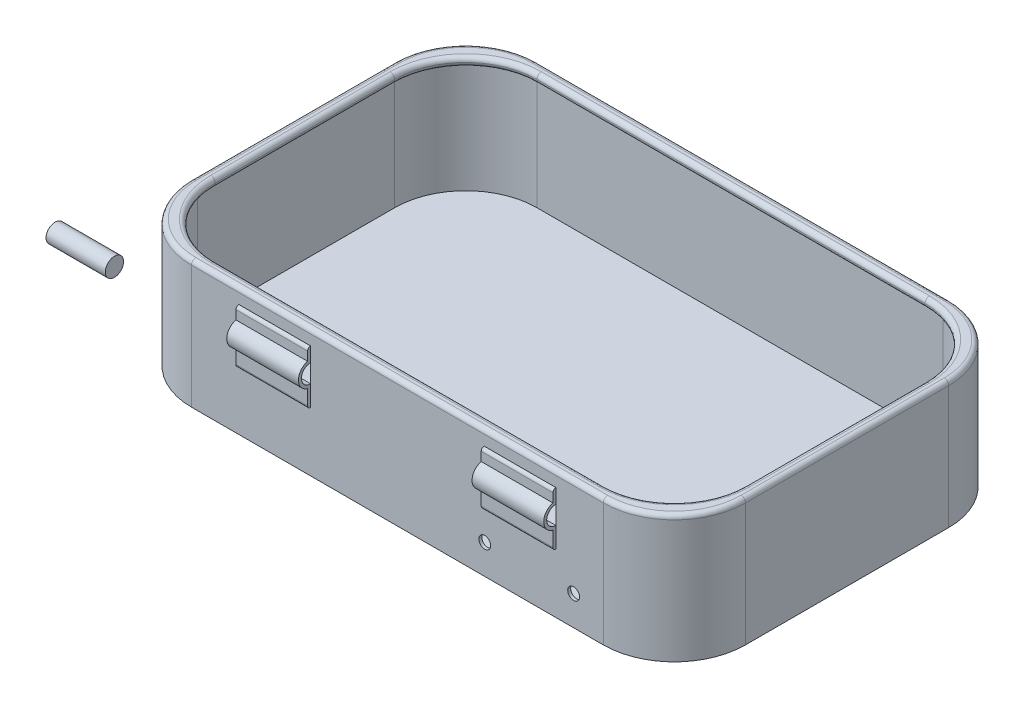
from build123d import *

# Parameters (mm, degrees)
SKETCH1_W           = 93.5
SKETCH1_H           = 58.3
BOSS_EXTRUDE1_DEPTH = 0.5
SKETCH2_W           = 93.5
SKETCH2_H           = 58.3
SKETCH2_W_2         = 92.5
SKETCH2_H_2         = 57.3
BOSS_EXTRUDE2_DEPTH = 21
SKETCH3_W           = 92.5
SKETCH3_H           = 57.3
SKETCH3_W_2         = 89.5
SKETCH3_H_2         = 54.3
BOSS_EXTRUDE3_DEPTH = 1.5
FILLET2_R           = 12
FILLET3_R           = 0.749
SKETCH4_W           = 12.1
SKETCH4_H           = 9
CUT_EXTRUDE1_DEPTH  = 0.5
BOSS_EXTRUDE4_START = -20
BOSS_EXTRUDE4_DEPTH = 12.1
BOSS_EXTRUDE5_START = -61.4
BOSS_EXTRUDE5_DEPTH = 12.1
FILLET4_R           = 0.5
FILLET5_R           = 0.5
SKETCH6_R           = 1.55
BOSS_EXTRUDE6_DEPTH = 10
SKETCH7_R           = 1
CUT_EXTRUDE2_DEPTH  = 0.5


with BuildPart() as part:
    # Sketch1 → Boss-Extrude1 (new body)
    with BuildSketch(Plane(origin=(0, 0, 0), x_dir=(1, 0, 0), z_dir=(0, 1, 0))):
        Rectangle(SKETCH1_W, SKETCH1_H)
    extrude(amount=BOSS_EXTRUDE1_DEPTH)

    # Sketch2 → Boss-Extrude2 (add)
    with BuildSketch(Plane(origin=(0, 0.5, 0), x_dir=(1, 0, 0), z_dir=(0, 1, 0))):
        Rectangle(SKETCH2_W, SKETCH2_H)
        Rectangle(SKETCH2_W_2, SKETCH2_H_2, mode=Mode.SUBTRACT)
    extrude(amount=BOSS_EXTRUDE2_DEPTH)

    # Sketch3 → Boss-Extrude3 (add)
    with BuildSketch(Plane(origin=(0, 21.5, 0), x_dir=(1, 0, 0), z_dir=(0, 1, 0))):
        Rectangle(SKETCH3_W, SKETCH3_H)
        Rectangle(SKETCH3_W_2, SKETCH3_H_2, mode=Mode.SUBTRACT)
    extrude(amount=-BOSS_EXTRUDE3_DEPTH)

    # Fillet2
    fillet2_edges = [part.edges().sort_by_distance(p)[0] for p in [
        (46.25, 10.25, -28.65),
        (-46.25, 10.25, -28.65),
        (46.25, 10.25, 28.65),
        (-46.25, 10.25, 28.65),
        (-44.75, 20.75, -27.15),
        (44.75, 20.75, -27.15),
        (44.75, 20.75, 27.15),
        (-44.75, 20.75, 27.15),
        (-46.75, 10.75, -29.15),
        (46.75, 10.75, -29.15),
        (46.75, 10.75, 29.15),
        (-46.75, 10.75, 29.15),
    ]]
    fillet(fillet2_edges, radius=FILLET2_R)

    # Fillet3
    fillet3_edges = [part.edges().sort_by_distance(p)[0] for p in [
        (-41.235281374, 20, 23.635281374),
        (41.235281374, 21.5, 23.635281374),
        (41.235281374, 20, 23.635281374),
        (41.235281374, 21.5, -23.635281374),
        (41.235281374, 20, -23.635281374),
        (43.235281374, 21.5, -25.635281374),
        (43.235281374, 21.5, 25.635281374),
        (-43.235281374, 21.5, 25.635281374),
        (-43.235281374, 21.5, -25.635281374),
        (-46.75, 21.5, 0),
        (0, 21.5, -29.15),
        (-44.75, 21.5, 0),
        (-44.75, 20, 0),
        (0, 21.5, -27.15),
        (0, 20, -27.15),
        (0, 21.5, 29.15),
        (0, 21.5, 27.15),
        (0, 20, 27.15),
        (44.75, 21.5, 0),
        (44.75, 20, 0),
        (46.75, 21.5, 0),
        (-41.235281374, 21.5, -23.635281374),
        (-41.235281374, 20, -23.635281374),
        (-41.235281374, 21.5, 23.635281374),
    ]]
    fillet(fillet3_edges, radius=FILLET3_R)

    # Sketch4 → Cut-Extrude1 (cut)
    with BuildSketch(Plane(origin=(0, 0, 28.65), x_dir=(-1, 0, 0), z_dir=(0, 0, -1))):
        with Locations((-20.7, 14.5)):
            Rectangle(SKETCH4_W, SKETCH4_H)
        with Locations((20.7, 14.5)):
            Rectangle(SKETCH4_W, SKETCH4_H)
    extrude(amount=-CUT_EXTRUDE1_DEPTH, mode=Mode.SUBTRACT)

    # Sketch7 → Cut-Extrude2 (cut)
    with BuildSketch(Plane.XY.offset(29.15)):
        with Locations((14.75, 5)):
            Circle(SKETCH7_R)
        with Locations((29.75, 5)):
            Circle(SKETCH7_R)
    extrude(amount=-CUT_EXTRUDE2_DEPTH, mode=Mode.SUBTRACT)


with BuildPart() as body_2:
    # Sketch5 → Boss-Extrude4 (new body)
    with BuildSketch(Plane.ZY.offset(46.75).offset(BOSS_EXTRUDE4_START)):
        with BuildLine():
            Line((29.65, 17), (29.65, 19))
            Line((29.65, 19), (29.15, 19))
            Line((29.15, 19), (29.15, 16.561910465))
            ThreePointArc((29.15, 16.561910465), (30.7, 15.011910465), (29.15, 13.461910465))
            Line((29.15, 13.461910465), (29.15, 10))
            Line((29.15, 10), (29.65, 10))
            Line((29.65, 10), (29.65, 13.02382093))
            ThreePointArc((29.65, 13.02382093), (31.2, 15.011910465), (29.65, 17))
        make_face()
    extrude(amount=-BOSS_EXTRUDE4_DEPTH)

    # Fillet4
    fillet4_edges = [body_2.edges().sort_by_distance(p)[0] for p in [
        (-20.7, 10, 29.65),
        (-20.7, 19, 29.65),
    ]]
    fillet(fillet4_edges, radius=FILLET4_R - 0.0001)  # a hair under: the kernel refuses the full size


with BuildPart() as body_3:
    # Sketch5<2> → Boss-Extrude5 (new body)
    with BuildSketch(Plane.ZY.offset(46.75).offset(BOSS_EXTRUDE5_START)):
        with BuildLine():
            Line((29.65, 17), (29.65, 19))
            Line((29.65, 19), (29.15, 19))
            Line((29.15, 19), (29.15, 16.561910465))
            ThreePointArc((29.15, 16.561910465), (30.7, 15.011910465), (29.15, 13.461910465))
            Line((29.15, 13.461910465), (29.15, 10))
            Line((29.15, 10), (29.65, 10))
            Line((29.65, 10), (29.65, 13.02382093))
            ThreePointArc((29.65, 13.02382093), (31.2, 15.011910465), (29.65, 17))
        make_face()
    extrude(amount=-BOSS_EXTRUDE5_DEPTH)

    # Fillet5
    fillet5_edges = [body_3.edges().sort_by_distance(p)[0] for p in [
        (20.7, 10, 29.65),
        (20.7, 19, 29.65),
    ]]
    fillet(fillet5_edges, radius=FILLET5_R - 0.0001)  # a hair under: the kernel refuses the full size


with BuildPart() as body_4:
    # Sketch6 → Boss-Extrude6 (new body)
    with BuildSketch(Plane.ZY.offset(46.75)):
        with Locations((30.15, 15.011910465)):
            Circle(SKETCH6_R)
    extrude(amount=BOSS_EXTRUDE6_DEPTH)


solid = Compound([part.part, body_2.part, body_3.part, body_4.part])
